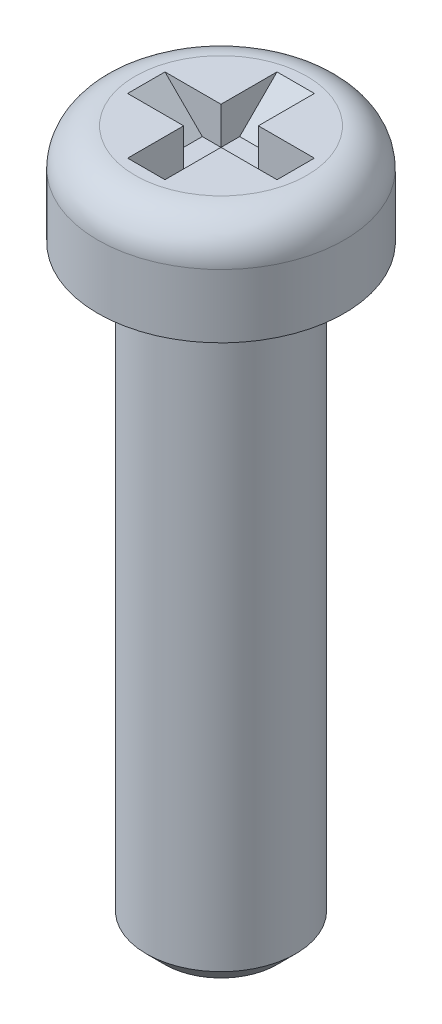
from build123d import *

# Parameters (mm, degrees)
SKETCH_1_R          = 2
EXTRUDE_1_DEPTH     = 16
SKETCH_2_R          = 3.3
EXTRUDE_2_DEPTH     = 2.7
FILLET_1_R          = 1
CHAMFER_1_SIZE      = 0.5
SKETCH_3_W          = 4
SKETCH_3_H          = 1
SKETCH_3_W_2        = 1
SKETCH_3_H_2        = 4
CUT_EXTRUDE_1_DEPTH = 1
CHAMFER_2_SIZE      = 1


with BuildPart() as part:
    # 草图1 → 凸台-拉伸1 (new body)
    with BuildSketch(Plane(origin=(0, 0, 0), x_dir=(1, 0, 0), z_dir=(0, 1, 0))):
        with Locations(Location((0, 0, 0), (0, 0, 270))):
            Circle(SKETCH_1_R)
    extrude(amount=EXTRUDE_1_DEPTH)

    # 草图2 → 凸台-拉伸2 (add)
    with BuildSketch(Plane(origin=(0, 16, 0), x_dir=(1, 0, 0), z_dir=(0, 1, 0))):
        with Locations(Location((0, 0, 0), (0, 0, 90))):
            Circle(SKETCH_2_R)
    extrude(amount=EXTRUDE_2_DEPTH)

    # 圆角1
    fillet_1_edges = [part.edges().sort_by_distance(p)[0] for p in [
        (0, 18.7, 3.3),
    ]]
    fillet(fillet_1_edges, radius=FILLET_1_R)

    # 倒角1
    chamfer_1_edges = [part.edges().sort_by_distance(p)[0] for p in [
        (0, 0, -2),
    ]]
    chamfer(chamfer_1_edges, length=CHAMFER_1_SIZE)

    # 草图3 → 切除-拉伸-薄壁1 (cut)
    with BuildSketch(Plane(origin=(0, 18.7, 0), x_dir=(1, 0, 0), z_dir=(0, 1, 0))):
        Rectangle(SKETCH_3_W, SKETCH_3_H)
        Rectangle(SKETCH_3_W_2, SKETCH_3_H_2)
    extrude(amount=-CUT_EXTRUDE_1_DEPTH, mode=Mode.SUBTRACT)

    # 倒角2
    chamfer_2_edges = [part.edges().sort_by_distance(p)[0] for p in [
        (0, 17.7, 2),
        (2, 17.7, 0),
        (0, 17.7, -2),
        (-2, 17.7, 0),
    ]]
    chamfer(chamfer_2_edges, length=CHAMFER_2_SIZE - 0.0001)  # a hair under: the kernel refuses the full size


solid = part.part
